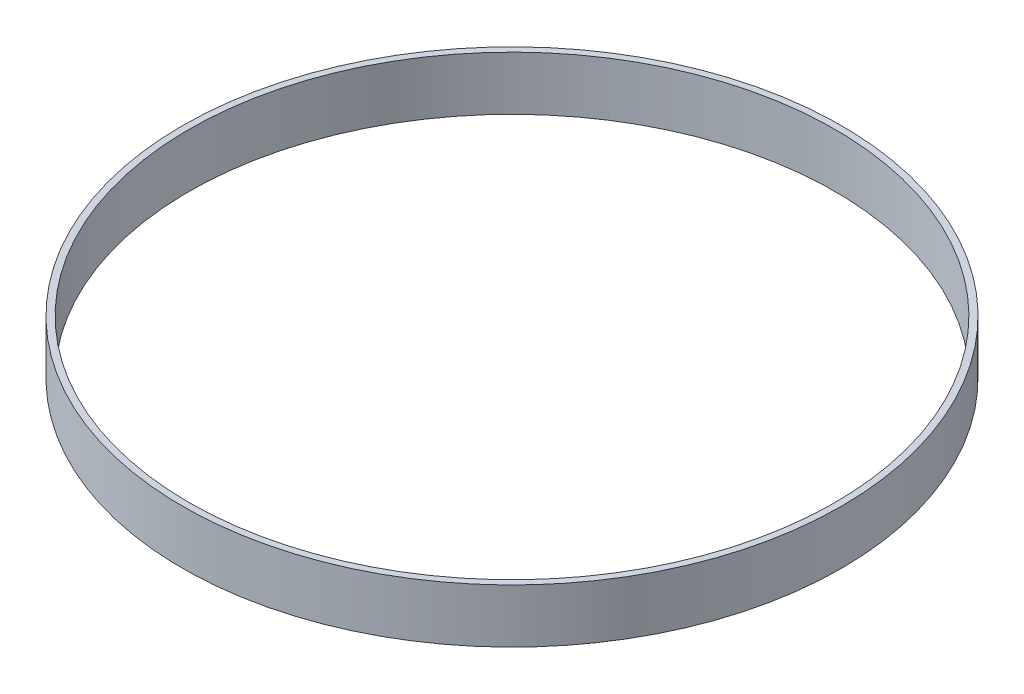
from build123d import *

# Parameters (mm, degrees)
SKETCH1_R           = 61.2
SKETCH1_R_2         = 60
EXTRUDE_THIN1_DEPTH = 10


with BuildPart() as part:
    # Sketch1 → Extrude-Thin1 (new body)
    with BuildSketch(Plane(origin=(0, 0, 0), x_dir=(1, 0, 0), z_dir=(0, 1, 0))):
        Circle(SKETCH1_R)
        Circle(SKETCH1_R_2, mode=Mode.SUBTRACT)
    extrude(amount=EXTRUDE_THIN1_DEPTH)


solid = part.part
